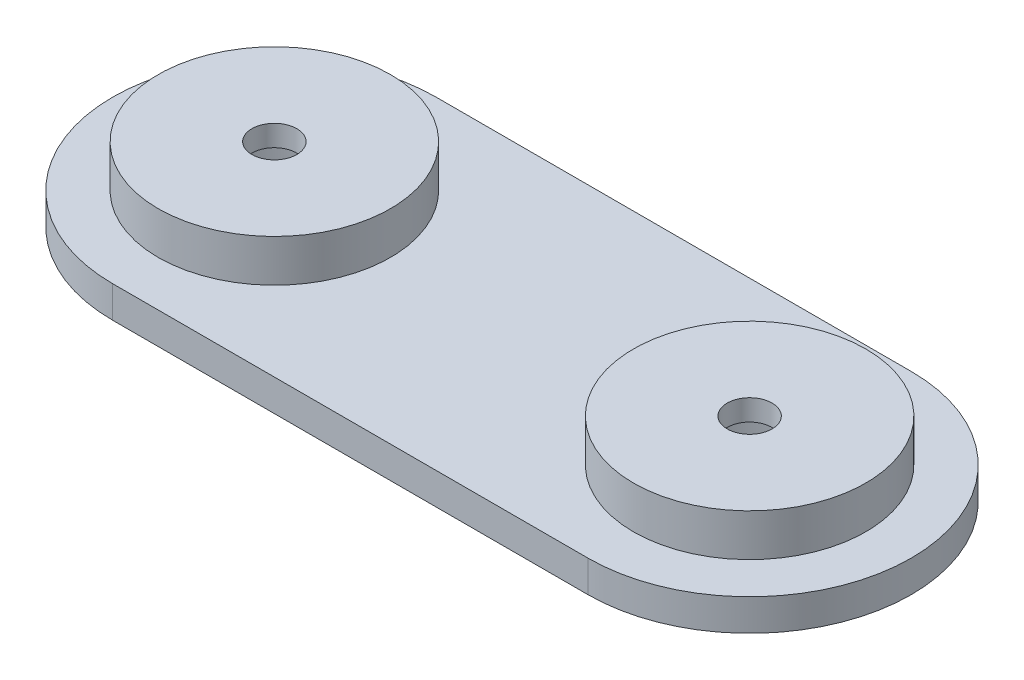
from build123d import *

# Parameters (mm, degrees)
BOSS_EXTRUDE1_DEPTH = 3
SKETCH2_R           = 9.75
CUT_EXTRUDE1_DEPTH  = 49.736551272
BOSS_EXTRUDE2_START = 2
SKETCH3_R           = 11
SKETCH3_R_2         = 9.75
BOSS_EXTRUDE2_DEPTH = 2
BOSS_EXTRUDE3_START = 2
SKETCH4_R           = 11
BOSS_EXTRUDE3_DEPTH = 2
SKETCH5_R           = 2.125
CUT_EXTRUDE2_DEPTH  = 2
SKETCH6_R           = 11
CUT_EXTRUDE3_DEPTH  = 2


with BuildPart() as part:
    # Sketch1 → Boss-Extrude1 (new body)
    with BuildSketch(Plane(origin=(0, 0, 0), x_dir=(1, 0, 0), z_dir=(0, 1, 0))):
        with BuildLine():
            Line((22.5, 0), (-22.5, 0))
            ThreePointArc((-22.5, 0), (-37.80530954, -15.30530954), (-22.5, -30.61061908))
            Line((-22.5, -30.61061908), (22.5, -30.61061908))
            ThreePointArc((22.5, -30.61061908), (37.80530954, -15.30530954), (22.5, 0))
        make_face()
    extrude(amount=BOSS_EXTRUDE1_DEPTH)

    # Sketch2 → Cut-Extrude1 (cut, through all)
    with BuildSketch(Plane(origin=(0, 3, 0), x_dir=(1, 0, 0), z_dir=(0, 1, 0))):
        with Locations((-22.5, -15.30530954)):
            Circle(SKETCH2_R)
        with Locations((22.5, -15.30530954)):
            Circle(SKETCH2_R)
    extrude(amount=-CUT_EXTRUDE1_DEPTH, mode=Mode.SUBTRACT)

    # Sketch3 → Boss-Extrude2 (add)
    # profile 1 of 2: a face of its own
    with BuildSketch(Plane(origin=(0, 3, 0), x_dir=(1, 0, 0), z_dir=(0, 1, 0)).offset(BOSS_EXTRUDE2_START)):
        with Locations((22.5, -15.30530954)):
            Circle(SKETCH3_R)
        with Locations((22.5, -15.30530954)):
            Circle(SKETCH3_R_2, mode=Mode.SUBTRACT)
    # profile 2 of 2: a face of its own
    with BuildSketch(Plane(origin=(0, 3, 0), x_dir=(1, 0, 0), z_dir=(0, 1, 0)).offset(BOSS_EXTRUDE2_START)):
        with Locations((-22.5, -15.30530954)):
            Circle(SKETCH3_R)
        with Locations((-22.5, -15.30530954)):
            Circle(SKETCH3_R_2, mode=Mode.SUBTRACT)
    boss_extrude2 = extrude(amount=-BOSS_EXTRUDE2_DEPTH)

    # Sketch4 → Boss-Extrude3 (add)
    with BuildSketch(Plane(origin=(0, 5, 0), x_dir=(1, 0, 0), z_dir=(0, 1, 0)).offset(BOSS_EXTRUDE3_START)):
        with Locations((22.5, -15.30530954)):
            Circle(SKETCH4_R)
        with Locations((-22.5, -15.30530954)):
            Circle(SKETCH4_R)
    boss_extrude3 = extrude(amount=-BOSS_EXTRUDE3_DEPTH)

    # Sketch5 → Cut-Extrude2 (cut)
    with BuildSketch(Plane(origin=(0, 7, 0), x_dir=(1, 0, 0), z_dir=(0, 1, 0))):
        with Locations((22.5, -15.30530954)):
            Circle(SKETCH5_R)
        with Locations((-22.5, -15.30530954)):
            Circle(SKETCH5_R)
    cut_extrude2 = extrude(amount=-CUT_EXTRUDE2_DEPTH, mode=Mode.SUBTRACT)

    # Mirror1: Boss-Extrude2, Boss-Extrude3, Cut-Extrude2 across plane
    add(boss_extrude2.mirror(Plane(origin=(0, 1.5, 0), x_dir=(0, 0, 1), z_dir=(0, -1, 0))))
    add(boss_extrude3.mirror(Plane(origin=(0, 1.5, 0), x_dir=(0, 0, 1), z_dir=(0, -1, 0))))
    add(cut_extrude2.mirror(Plane(origin=(0, 1.5, 0), x_dir=(0, 0, 1), z_dir=(0, -1, 0))), mode=Mode.SUBTRACT)

    # Sketch6 → Cut-Extrude3 (cut)
    with BuildSketch(Plane.XZ.offset(4)):
        with Locations((22.5, 15.30530954)):
            Circle(SKETCH6_R)
        with Locations((-22.5, 15.30530954)):
            Circle(SKETCH6_R)
    extrude(amount=-CUT_EXTRUDE3_DEPTH, mode=Mode.SUBTRACT)


solid = part.part
